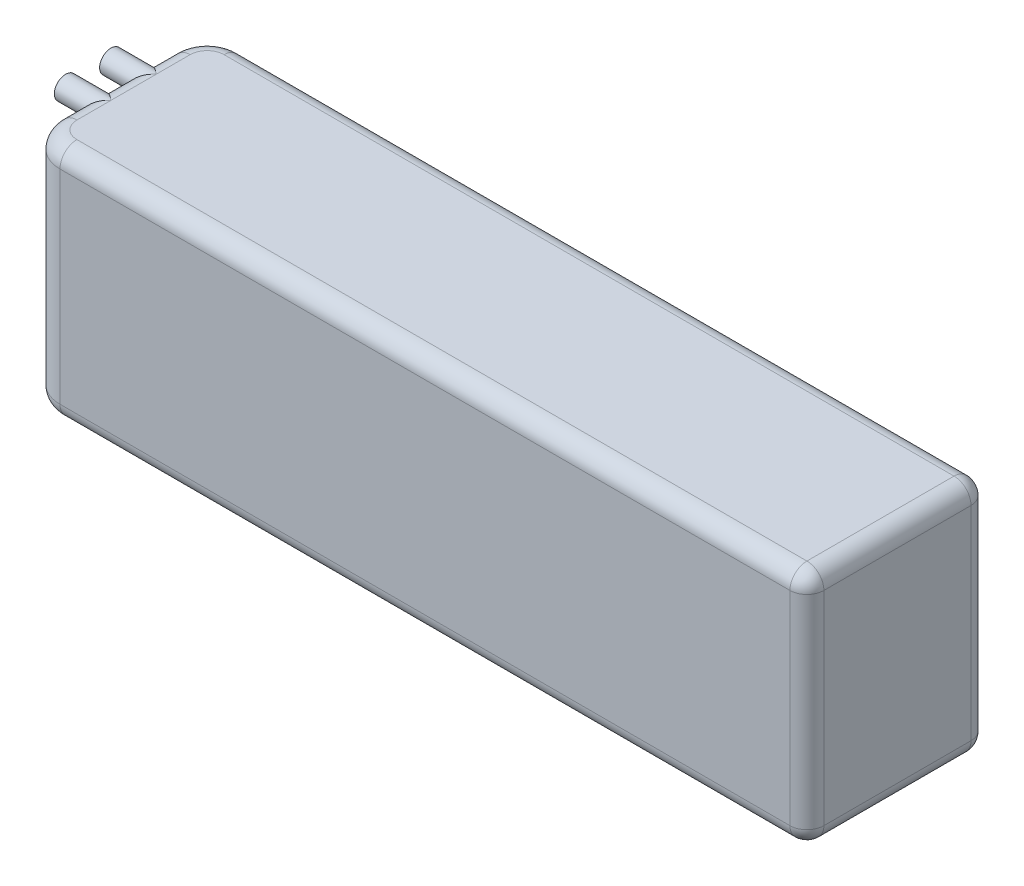
from build123d import *

# Parameters (mm, degrees)
SKETCH1_W           = 138
SKETCH1_H           = 32
BOSS_EXTRUDE1_DEPTH = 42
SKETCH2_R           = 2
BOSS_EXTRUDE2_DEPTH = 5
FILLET1_R           = 6
FILLET2_R           = 3


with BuildPart() as part:
    # Sketch1 → Boss-Extrude1 (new body)
    with BuildSketch(Plane(origin=(0, 0, 0), x_dir=(1, 0, 0), z_dir=(0, 1, 0))):
        with Locations((69, 16)):
            Rectangle(SKETCH1_W, SKETCH1_H)
    extrude(amount=BOSS_EXTRUDE1_DEPTH)

    # Sketch2 → Boss-Extrude2 (add)
    with BuildSketch(Plane.ZY):
        with Locations(Location((-12, 40, 0), (0, 0, 90))):
            Circle(SKETCH2_R)
        with Locations(Location((-20, 40, 0), (0, 0, 90))):
            Circle(SKETCH2_R)
    extrude(amount=BOSS_EXTRUDE2_DEPTH)

    # Fillet1
    fillet1_edges = [part.edges().sort_by_distance(p)[0] for p in [
        (0, 21, -32),
        (0, 21, 0),
    ]]
    fillet(fillet1_edges, radius=FILLET1_R)

    # Fillet2
    # the kernel refuses this fillet: 3 mm, written as the material it takes off along each edge
    with BuildSketch(Plane(origin=(135, 39, -3), x_dir=(1, 0, 0), z_dir=(0, 0, 1))) as fillet2_piece_1_section:
        Polygon((0, 0), (FILLET2_R * 1.02, 0), (FILLET2_R * 1.02, FILLET2_R * 1.02), (0, FILLET2_R * 1.02), align=None)
    fillet2_piece_1 = extrude(amount=FILLET2_R * 1.02, mode=Mode.PRIVATE)
    fillet2_piece_1 = fillet2_piece_1 - Plane(origin=(135, 39, -3), x_dir=(-0.7071067811865475, -0.7071067811865475, 0), z_dir=(0, 0, 1)) * Sphere(FILLET2_R, mode=Mode.PRIVATE)
    add(fillet2_piece_1, mode=Mode.SUBTRACT)
    with BuildSketch(Plane(origin=(135, 39, -29), x_dir=(0, 1, 0), z_dir=(1, 0, 0))) as fillet2_piece_2_section:
        Polygon((0, 0), (FILLET2_R * 1.02, 0), (FILLET2_R * 1.02, -FILLET2_R * 1.02), (0, -FILLET2_R * 1.02), align=None)
    fillet2_piece_2 = extrude(amount=FILLET2_R * 1.02, mode=Mode.PRIVATE)
    fillet2_piece_2 = fillet2_piece_2 - Plane(origin=(135, 39, -29), x_dir=(0, -0.7071067811865475, 0.7071067811865475), z_dir=(1, 0, 0)) * Sphere(FILLET2_R, mode=Mode.PRIVATE)
    add(fillet2_piece_2, mode=Mode.SUBTRACT)
    with BuildSketch(Plane(origin=(135, 3, -3), x_dir=(0, -1, 0), z_dir=(0, 0, 1))) as fillet2_piece_3_section:
        Polygon((0, 0), (FILLET2_R * 1.02, 0), (FILLET2_R * 1.02, FILLET2_R * 1.02), (0, FILLET2_R * 1.02), align=None)
    fillet2_piece_3 = extrude(amount=FILLET2_R * 1.02, mode=Mode.PRIVATE)
    fillet2_piece_3 = fillet2_piece_3 - Plane(origin=(135, 3, -3), x_dir=(-0.7071067811865475, 0.7071067811865475, 0), z_dir=(0, 0, 1)) * Sphere(FILLET2_R, mode=Mode.PRIVATE)
    add(fillet2_piece_3, mode=Mode.SUBTRACT)
    with BuildSketch(Plane(origin=(135, 3, -29), x_dir=(1, 0, 0), z_dir=(0, -1, 0))) as fillet2_piece_4_section:
        Polygon((0, 0), (FILLET2_R * 1.02, 0), (FILLET2_R * 1.02, -FILLET2_R * 1.02), (0, -FILLET2_R * 1.02), align=None)
    fillet2_piece_4 = extrude(amount=FILLET2_R * 1.02, mode=Mode.PRIVATE)
    fillet2_piece_4 = fillet2_piece_4 - Plane(origin=(135, 3, -29), x_dir=(-0.7071067811865475, 0, 0.7071067811865475), z_dir=(0, -1, 0)) * Sphere(FILLET2_R, mode=Mode.PRIVATE)
    add(fillet2_piece_4, mode=Mode.SUBTRACT)
    with BuildSketch(Plane(origin=(138, 42, -3), x_dir=(0, -1, 0), z_dir=(0, 0, -1)), Plane(origin=(138, 0, -3), x_dir=(-1, 0, 0), z_dir=(0, 0, -1))) as fillet2_piece_5:
        with BuildLine():
            CenterArc((FILLET2_R, FILLET2_R), FILLET2_R, 180, 90)
            Line((0, FILLET2_R), (0, 0))
            Line((0, 0), (FILLET2_R, 0))
        make_face()
    extrude(amount=26, mode=Mode.SUBTRACT)
    with BuildSketch(Plane(origin=(0, 42, -12), x_dir=(1, 0, 0), z_dir=(0, 0, 1))) as fillet2_piece_6_section:
        with BuildLine():
            CenterArc((FILLET2_R, -FILLET2_R), FILLET2_R, 90, 90)
            Line((0, -FILLET2_R), (0, 0))
            Line((0, 0), (FILLET2_R, 0))
        make_face()
    fillet2_piece_6 = extrude(amount=6, mode=Mode.PRIVATE)
    fillet2_piece_6 = fillet2_piece_6 - Plane(origin=(0.483529934, 40, -12), x_dir=(0, 1, 0), z_dir=(1, 0, 0)) * Cylinder(2, 24, mode=Mode.PRIVATE)
    add(fillet2_piece_6, mode=Mode.SUBTRACT)
    with BuildSketch(Plane(origin=(135, 42, -32), x_dir=(0, 0, 1), z_dir=(-1, 0, 0)), Plane(origin=(6, 0, 0), x_dir=(0, 1, 0), z_dir=(1, 0, 0))) as fillet2_piece_7:
        with BuildLine():
            CenterArc((FILLET2_R, -FILLET2_R), FILLET2_R, 90, 90)
            Line((0, -FILLET2_R), (0, 0))
            Line((0, 0), (FILLET2_R, 0))
        make_face()
    extrude(amount=129, mode=Mode.SUBTRACT)
    with BuildSketch(Plane(origin=(0, 42, -20), x_dir=(1, 0, 0), z_dir=(0, 0, 1))) as fillet2_piece_8_section:
        with BuildLine():
            CenterArc((FILLET2_R, -FILLET2_R), FILLET2_R, 90, 90)
            Line((0, -FILLET2_R), (0, 0))
            Line((0, 0), (FILLET2_R, 0))
        make_face()
    fillet2_piece_8 = extrude(amount=8, mode=Mode.PRIVATE)
    fillet2_piece_8 = fillet2_piece_8 - Plane(origin=(0.736023116, 40, -20), x_dir=(0, 1, 0), z_dir=(1, 0, 0)) * Cylinder(2, 28, mode=Mode.PRIVATE)
    fillet2_piece_8 = fillet2_piece_8 - Plane(origin=(0.736023116, 40, -12), x_dir=(0, 1, 0), z_dir=(1, 0, 0)) * Cylinder(2, 28, mode=Mode.PRIVATE)
    add(fillet2_piece_8, mode=Mode.SUBTRACT)
    with BuildSketch(Plane(origin=(0, 42, -26), x_dir=(1, 0, 0), z_dir=(0, 0, 1))) as fillet2_piece_9_section:
        with BuildLine():
            CenterArc((FILLET2_R, -FILLET2_R), FILLET2_R, 90, 90)
            Line((0, -FILLET2_R), (0, 0))
            Line((0, 0), (FILLET2_R, 0))
        make_face()
    fillet2_piece_9 = extrude(amount=6, mode=Mode.PRIVATE)
    fillet2_piece_9 = fillet2_piece_9 - Plane(origin=(0.914317851, 40, -20), x_dir=(0, 1, 0), z_dir=(1, 0, 0)) * Cylinder(2, 24, mode=Mode.PRIVATE)
    add(fillet2_piece_9, mode=Mode.SUBTRACT)
    with BuildSketch(Plane(origin=(0, 0, -26), x_dir=(1, 0, 0), z_dir=(0, 0, 1))) as fillet2_piece_10:
        with BuildLine():
            CenterArc((FILLET2_R, FILLET2_R), FILLET2_R, 180, 90)
            Line((0, FILLET2_R), (0, 0))
            Line((0, 0), (FILLET2_R, 0))
        make_face()
    extrude(amount=20, mode=Mode.SUBTRACT)
    with BuildSketch(Plane(origin=(6, 0, -6), x_dir=(0, 0, 1), z_dir=(1, 0, 0))) as fillet2_piece_11:
        with BuildLine():
            CenterArc((6 - FILLET2_R, -FILLET2_R), FILLET2_R, 0, 90)
            Line((6, -FILLET2_R), (6, 0))
            Line((6, 0), (6 - FILLET2_R, 0))
        make_face()
    revolve(axis=Axis((6, 0, -6), (0, -1, 0)), revolution_arc=90, mode=Mode.SUBTRACT)
    with BuildSketch(Plane(origin=(6, 0, -26), x_dir=(-1, 0, 0), z_dir=(0, 0, 1))) as fillet2_piece_12:
        with BuildLine():
            CenterArc((6 - FILLET2_R, -FILLET2_R), FILLET2_R, 0, 90)
            Line((6, -FILLET2_R), (6, 0))
            Line((6, 0), (6 - FILLET2_R, 0))
        make_face()
    revolve(axis=Axis((6, 0, -26), (0, -1, 0)), revolution_arc=90, mode=Mode.SUBTRACT)
    with BuildSketch(Plane(origin=(6, 42, 0), x_dir=(0, -1, 0), z_dir=(1, 0, 0)), Plane(origin=(135, 0, -32), x_dir=(0, 0, 1), z_dir=(-1, 0, 0))) as fillet2_piece_13:
        with BuildLine():
            CenterArc((FILLET2_R, FILLET2_R), FILLET2_R, 180, 90)
            Line((0, FILLET2_R), (0, 0))
            Line((0, 0), (FILLET2_R, 0))
        make_face()
    extrude(amount=129, mode=Mode.SUBTRACT)
    with BuildSketch(Plane(origin=(6, 42, -6), x_dir=(0, 0, 1), z_dir=(1, 0, 0))) as fillet2_piece_14:
        with BuildLine():
            CenterArc((6 - FILLET2_R, FILLET2_R), FILLET2_R, 270, 90)
            Line((6 - FILLET2_R, 0), (6, 0))
            Line((6, 0), (6, FILLET2_R))
        make_face()
    revolve(axis=Axis((6, 42, -6), (0, -1, 0)), revolution_arc=90, mode=Mode.SUBTRACT)
    with BuildSketch(Plane(origin=(6, 42, -26), x_dir=(-1, 0, 0), z_dir=(0, 0, 1))) as fillet2_piece_15:
        with BuildLine():
            CenterArc((6 - FILLET2_R, FILLET2_R), FILLET2_R, 270, 90)
            Line((6, FILLET2_R), (6, 0))
            Line((6, 0), (6 - FILLET2_R, 0))
        make_face()
    revolve(axis=Axis((6, 42, -26), (0, -1, 0)), revolution_arc=90, mode=Mode.SUBTRACT)
    with BuildSketch(Plane(origin=(138, 3, -32), x_dir=(0, 0, 1), z_dir=(0, 1, 0)), Plane(origin=(138, 3, 0), x_dir=(-1, 0, 0), z_dir=(0, 1, 0))) as fillet2_piece_16:
        with BuildLine():
            CenterArc((FILLET2_R, -FILLET2_R), FILLET2_R, 90, 90)
            Line((0, -FILLET2_R), (0, 0))
            Line((0, 0), (FILLET2_R, 0))
        make_face()
    extrude(amount=36, mode=Mode.SUBTRACT)


solid = part.part
